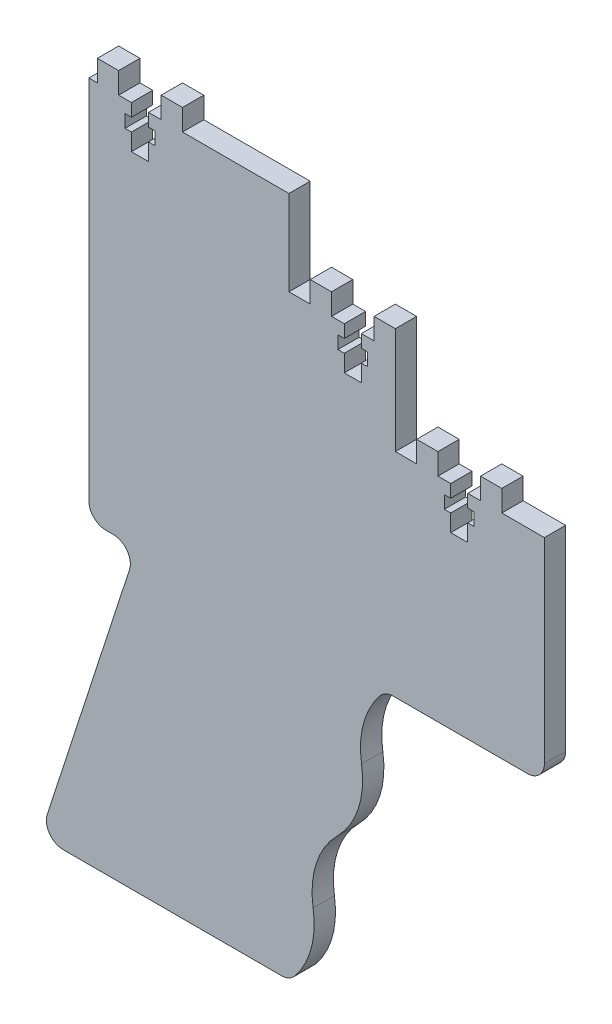
from build123d import *

# Parameters (mm, degrees)
BOSS_EXTRU_1_DEPTH = 5
CONG_1_R           = 4


with BuildPart() as part:
    # Esquisse1 → Boss.-Extru.1 (new body)
    with BuildSketch(Plane.XY):
        with BuildLine():
            Line((10, -20), (10, 0))
            Line((10, 0), (10, 5))
            Line((10, 5), (5, 5))
            Line((5, 5), (5, 0))
            Line((5, 0), (2, 0))
            Line((2, 0), (2, -3))
            Line((2, -3), (3.5, -3))
            Line((3.5, -3), (3.5, -6))
            Line((3.5, -6), (2, -6))
            Line((2, -6), (2, -10))
            Line((2, -10), (-2, -10))
            Line((-2, -10), (-2, -6))
            Line((-2, -6), (-3.5, -6))
            Line((-3.5, -6), (-3.5, -3))
            Line((-3.5, -3), (-2, -3))
            Line((-2, -3), (-2, 0))
            Line((-2, 0), (-5, 0))
            Line((-5, 0), (-5, 5))
            Line((-5, 5), (-10, 5))
            Line((-10, 5), (-10, 0))
            Line((-10, 0), (-15, 0))
            Line((-15, 0), (-15, 20))
            Line((-15, 20), (-40, 20))
            Line((-40, 20), (-40, 25))
            Line((-40, 25), (-45, 25))
            Line((-45, 25), (-45, 20))
            Line((-45, 20), (-48, 20))
            Line((-48, 20), (-48, 17))
            Line((-48, 17), (-46.5, 17))
            Line((-46.5, 17), (-46.5, 14))
            Line((-46.5, 14), (-48, 14))
            Line((-48, 14), (-48, 10))
            Line((-48, 10), (-52, 10))
            Line((-52, 10), (-52, 14))
            Line((-52, 14), (-53.5, 14))
            Line((-53.5, 14), (-53.5, 17))
            Line((-53.5, 17), (-52, 17))
            Line((-52, 17), (-52, 20))
            Line((-52, 20), (-55, 20))
            Line((-55, 20), (-55, 25))
            Line((-55, 25), (-60, 25))
            Line((-60, 25), (-60, 20))
            Line((-60, 20), (-62, 20))
            Line((-62, 20), (-62, -70))
            Line((-62, -70), (-50.744378736, -70))
            Line((-50.744378736, -70), (-73.488757473, -140))
            Line((-73.488757473, -140), (-15, -140))
            ThreePointArc((-15, -140), (-10.049924347, -131.934614999), (-9.313905316, -122.5))
            ThreePointArc((-9.313905316, -122.5), (-8.577886284, -113.065385001), (-3.627810632, -105))
            ThreePointArc((-3.627810632, -105), (1.322265021, -96.934614999), (2.058284052, -87.5))
            ThreePointArc((2.058284052, -87.5), (2.794303084, -78.065385001), (7.744378736, -70))
            Line((7.744378736, -70), (45, -70))
            Line((45, -70), (45, -20))
            Line((45, -20), (35, -20))
            Line((35, -20), (35, -15))
            Line((35, -15), (30, -15))
            Line((30, -15), (30, -20))
            Line((30, -20), (27, -20))
            Line((27, -20), (27, -23))
            Line((27, -23), (28.5, -23))
            Line((28.5, -23), (28.5, -26))
            Line((28.5, -26), (27, -26))
            Line((27, -26), (27, -30))
            Line((27, -30), (23, -30))
            Line((23, -30), (23, -26))
            Line((23, -26), (21.5, -26))
            Line((21.5, -26), (21.5, -23))
            Line((21.5, -23), (23, -23))
            Line((23, -23), (23, -20))
            Line((23, -20), (20, -20))
            Line((20, -20), (20, -15))
            Line((20, -15), (15, -15))
            Line((15, -15), (15, -20))
            Line((15, -20), (10, -20))
        make_face()
    extrude(amount=BOSS_EXTRU_1_DEPTH)

    # Congé1
    cong_1_edges = [part.edges().sort_by_distance(p)[0] for p in [
        (-15, -140, 2.5),
        (7.744378736, -70, 2.5),
        (45, -70, 2.5),
        (-73.488757473, -140, 2.5),
        (-62, -70, 2.5),
        (-50.744378736, -70, 2.5),
    ]]
    fillet(cong_1_edges, radius=CONG_1_R)


solid = part.part
